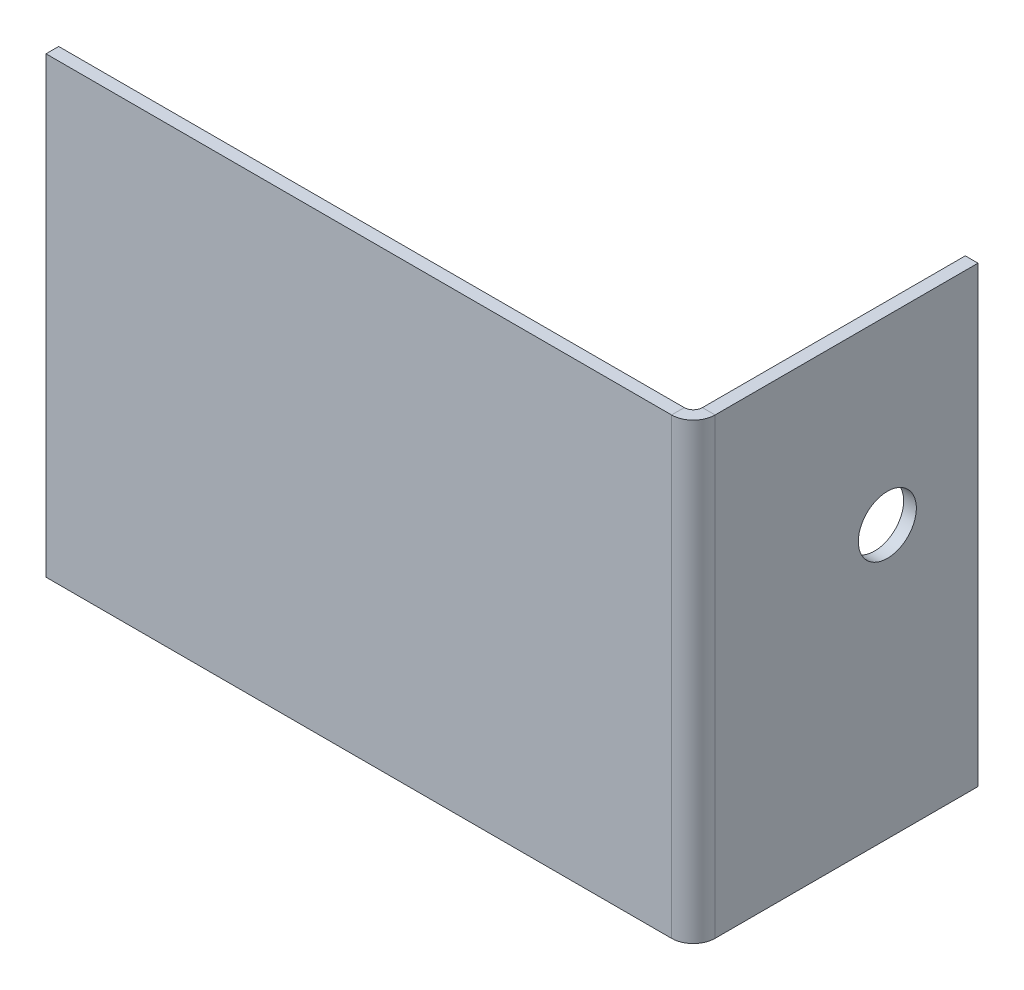
from build123d import *

# Parameters (mm, degrees)
SKETCH1_W                    = 35
SKETCH1_H                    = 25
BASE_FLANGE1_DEPTH           = 0.7
EDGE_FLANGE1_STRIP_W         = 3.8
EDGE_FLANGE1_STRIP_H         = 0.7
EDGE_FLANGE1_STRIP_CUT_DEPTH = 25
EDGE_FLANGE1_DEPTH           = 25
SKETCH10_R                   = 1.6
CUT_EXTRUDE1_DEPTH           = 0.7


# Sheet-metal steps are written as plain solids
with BuildPart() as part:
    # Sketch1 → Base-Flange1 (new body)
    with BuildSketch(Plane.XY):
        Rectangle(SKETCH1_W, SKETCH1_H)
    extrude(amount=-BASE_FLANGE1_DEPTH)

    # Edge-Flange1 strip (across the edge) → Edge-Flange1 strip cut (cut)
    with BuildSketch(Plane(origin=(17.5, 12.5, -0.7), x_dir=(-1, 0, 0), z_dir=(0, -1, 0))):
        with Locations((-1.4, -0.35)):
            Rectangle(EDGE_FLANGE1_STRIP_W, EDGE_FLANGE1_STRIP_H)
    extrude(amount=EDGE_FLANGE1_STRIP_CUT_DEPTH, mode=Mode.SUBTRACT)

    # Edge-Flange1 section (across the edge) → Edge-Flange1 (add)
    with BuildSketch(Plane(origin=(17.5, 12.5, -0.7), x_dir=(-1, 0, 0), z_dir=(0, -1, 0))):
        with BuildLine():
            Line((-0.7, 0.5), (-0.7, 15))
            Line((-0.7, 15), (0, 15))
            Line((0, 15), (0, 0.5))
            ThreePointArc((0, 0.5), (0.146446609, 0.146446609), (0.5, 0))
            Line((0.5, 0), (0.5, -0.7))
            ThreePointArc((0.5, -0.7), (-0.348528137, -0.348528137), (-0.7, 0.5))
        make_face()
    extrude(amount=EDGE_FLANGE1_DEPTH)

    # Sketch10 → Cut-Extrude1 (cut)
    with BuildSketch(Plane.ZY.offset(-17.5)):
        with Locations((-10.7, 2.5)):
            Circle(SKETCH10_R)
    extrude(amount=-CUT_EXTRUDE1_DEPTH, mode=Mode.SUBTRACT)


solid = part.part
